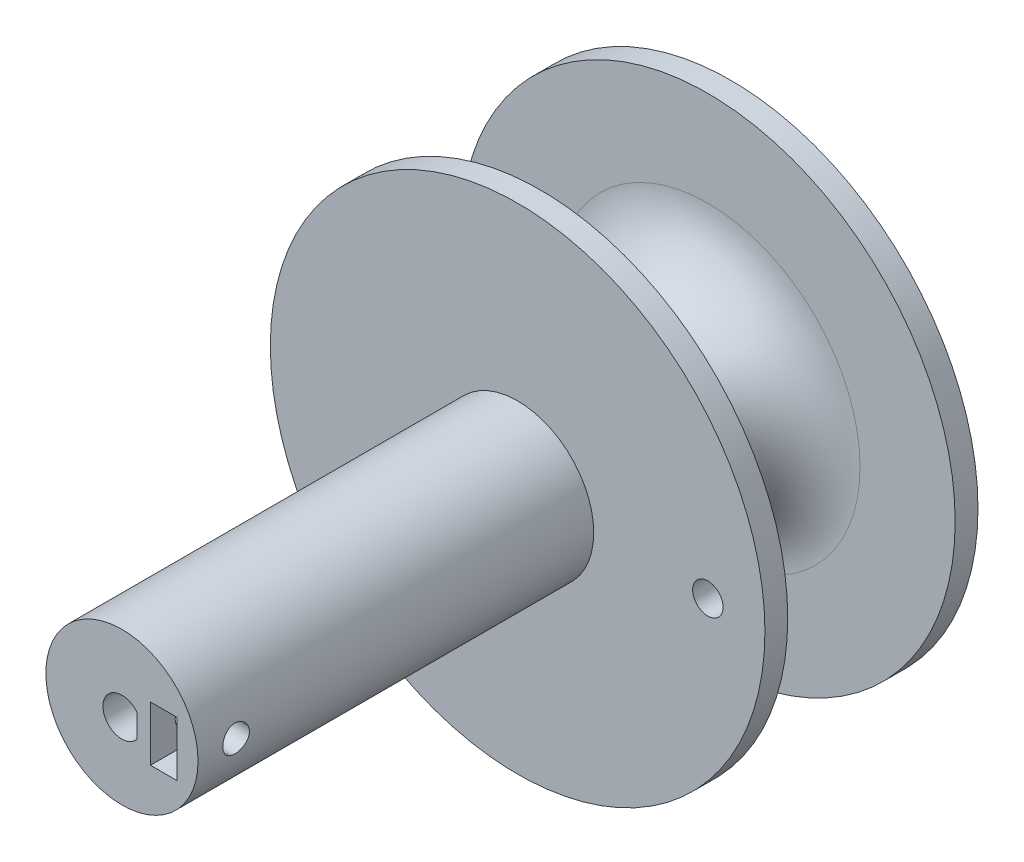
from build123d import *

# Parameters (mm, degrees)
CROQUIS1_R              = 10
SALIENTE_EXTRUIR2_DEPTH = 80
CROQUIS4_R              = 32.5
SALIENTE_EXTRUIR3_DEPTH = 3
SALIENTE_EXTRUIR4_START = 25
CROQUIS5_R              = 32.5
SALIENTE_EXTRUIR4_DEPTH = 3
REDONDEO2_R             = 10
CORTAR_EXTRUIR1_START   = 80
CORTAR_EXTRUIR1_DEPTH   = 20
CORTAR_EXTRUIR2_START   = 80
CROQUIS7_W              = 3.5
CROQUIS7_H              = 7.2
CORTAR_EXTRUIR2_DEPTH   = 10
CORTAR_EXTRUIR3_START   = 1.785357468
CORTAR_EXTRUIR3_DEPTH   = 8.214642632
CORTAR_EXTRUIR4_START   = 25
CROQUIS9_R              = 2
CORTAR_EXTRUIR4_DEPTH   = 3


# Read off the part's stored shape, not the designer's step: Cortar-Extruir3
with BuildPart() as part:
    # Croquis1 → Saliente-Extruir2 (new body)
    with BuildSketch(Plane.XY):
        Circle(CROQUIS1_R)
    extrude(amount=SALIENTE_EXTRUIR2_DEPTH)

    # Croquis4 → Saliente-Extruir3 (add)
    with BuildSketch(Plane.XY):
        Circle(CROQUIS4_R)
    extrude(amount=SALIENTE_EXTRUIR3_DEPTH)

    # Croquis5 → Saliente-Extruir4 (add)
    with BuildSketch(Plane.XY.offset(SALIENTE_EXTRUIR4_START)):
        Circle(CROQUIS5_R)
    extrude(amount=SALIENTE_EXTRUIR4_DEPTH)

    # Redondeo2
    redondeo2_edges = [part.edges().sort_by_distance(p)[0] for p in [
        (-10, 0, 25),
        (-10, 0, 3),
    ]]
    fillet(redondeo2_edges, radius=REDONDEO2_R)

    # Croquis6 → Cortar-Extruir1 (cut)
    with BuildSketch(Plane.XY.offset(CORTAR_EXTRUIR1_START)):
        with BuildLine():
            Line((2, 1.5), (2, -1.5))
            ThreePointArc((2, -1.5), (-2.5, 0), (2, 1.5))
        make_face()
    extrude(amount=-CORTAR_EXTRUIR1_DEPTH, mode=Mode.SUBTRACT)

    # Croquis7 → Cortar-Extruir2 (cut)
    with BuildSketch(Plane.XY.offset(CORTAR_EXTRUIR2_START)):
        with Locations((5.5, 0)):
            Rectangle(CROQUIS7_W, CROQUIS7_H)
    extrude(amount=-CORTAR_EXTRUIR2_DEPTH, mode=Mode.SUBTRACT)

    # Cortar-Extruir3 outline → Cortar-Extruir3 (cut)
    with BuildSketch(Plane(origin=(0, 0, 0), x_dir=(0, 0, -1), z_dir=(1, 0, 0)).offset(CORTAR_EXTRUIR3_START)):
        with BuildLine():
            add(Edge.make_bspline(
                [(-73.250000008, 0), (-73.250010298, 0.457042806), (-73.439269311, 0.913556657), (-73.761440573, 1.236313288), (-74.083774062, 1.559232356), (-74.536167707, 1.749638189), (-74.998632957, 1.749999466), (-75.46109828, 1.75036072), (-75.914256207, 1.560125437), (-76.558728463, 0.916635921), (-76.75, 0.463408547), (-76.75, -0.463408547), (-76.559497121, -0.915462775), (-75.915045576, -1.559741953), (-75.458501248, -1.749734355), (-74.543528816, -1.750265056), (-74.088756627, -1.563446648), (-73.437067231, -0.912124478), (-73.250180582, -0.457964068), (-73.250000045, -0.000460382), (-73.250000003, -0.000230191), (-73.250000008, 0)],
                knots=[0.500062925, 0.500062925, 0.500062925, 0.500062925, 0.625, 0.625, 0.625000034, 0.750000005, 0.750000005, 0.750000019, 0.875000002, 0.875000002, 0.999999997, 0.999999997, 1.124999993, 1.124999993, 1.24999999, 1.24999999, 1.374999987, 1.374999987, 1.499999981, 1.499999981, 1.500062906, 1.500062906, 1.500062906, 1.500062906], degree=3))
        make_face()
    extrude(amount=CORTAR_EXTRUIR3_DEPTH, mode=Mode.SUBTRACT)

    # Croquis9 → Cortar-Extruir4 (cut)
    with BuildSketch(Plane.XY.offset(CORTAR_EXTRUIR4_START)):
        with Locations((25, 0)):
            Circle(CROQUIS9_R)
    extrude(amount=CORTAR_EXTRUIR4_DEPTH, mode=Mode.SUBTRACT)


solid = part.part
